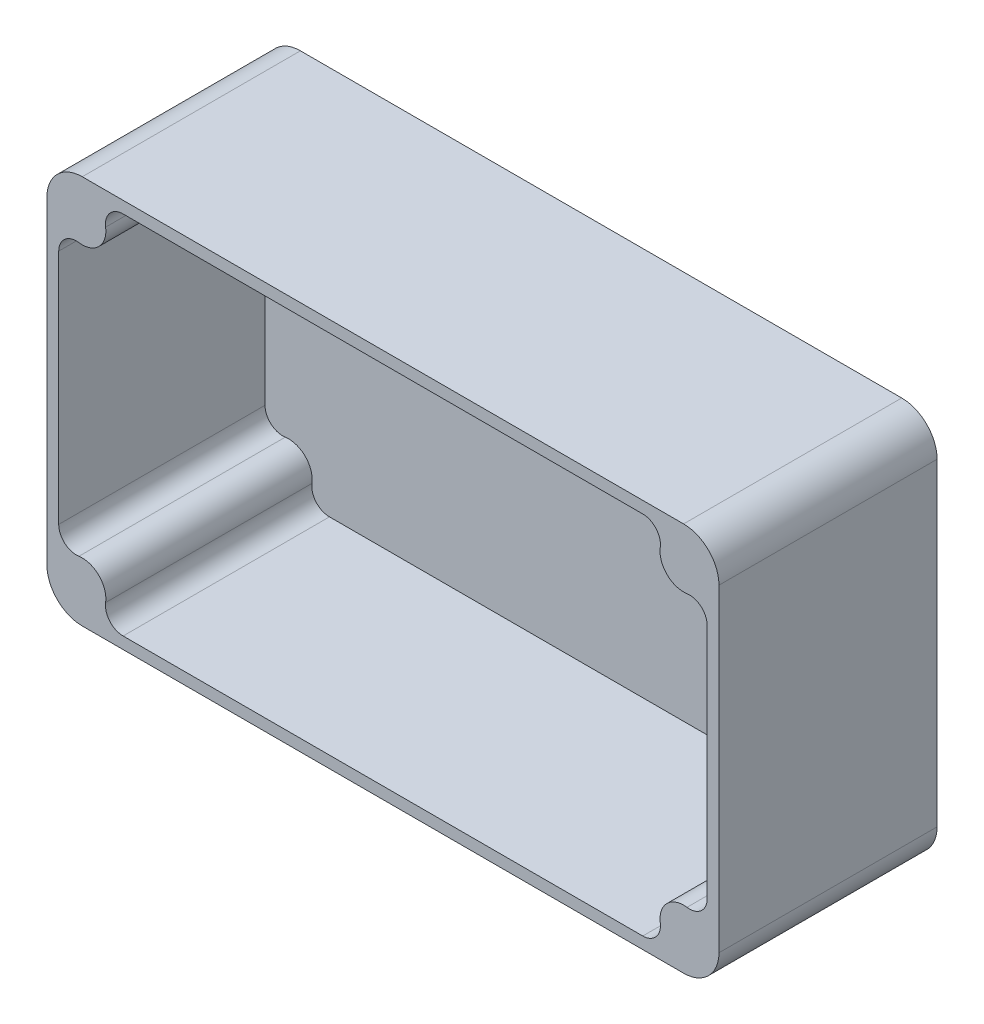
from build123d import *

# Parameters (mm, degrees)
BOSS_EXTRUDE1_DEPTH = 35
SHELL1_T            = 2
SKETCH2_R           = 4
BOSS_EXTRUDE2_DEPTH = 35
FILLET2_START       = -1
FILLET2_DEPTH       = 36


with BuildPart() as part:
    # Sketch1 → Boss-Extrude1 (new body)
    with BuildSketch(Plane.XY):
        with BuildLine():
            Line((-51, -31), (51, -31))
            ThreePointArc((51, -31), (53.828427125, -29.828427125), (55, -27))
            Line((55, -27), (55, 27))
            ThreePointArc((55, 27), (53.828427125, 29.828427125), (51, 31))
            Line((51, 31), (-51, 31))
            ThreePointArc((-51, 31), (-53.828427125, 29.828427125), (-55, 27))
            Line((-55, 27), (-55, -27))
            ThreePointArc((-55, -27), (-53.828427125, -29.828427125), (-51, -31))
        make_face()
    extrude(amount=BOSS_EXTRUDE1_DEPTH)

    # Shell1
    shell1_openings = [part.faces().sort_by_distance(p)[0] for p in [
        (0, 0, 35),
    ]]
    offset(amount=SHELL1_T, openings=shell1_openings, kind=Kind.INTERSECTION)

    # Sketch2 → Boss-Extrude2 (add)
    with BuildSketch(Plane.XY):
        with Locations((-51, 27)):
            Circle(SKETCH2_R)
        with Locations((51, 27)):
            Circle(SKETCH2_R)
        with Locations((51, -27)):
            Circle(SKETCH2_R)
        with Locations((-51, -27)):
            Circle(SKETCH2_R)
    extrude(amount=BOSS_EXTRUDE2_DEPTH)

    # Fillet2: read off the stored shape, not the designer's step
    # Fillet2 outline → Fillet2 (add)
    with BuildSketch(Plane.XY.offset(FILLET2_START)):
        with BuildLine():
            ThreePointArc((51, -31), (48.381385317, -30.023715784), (47.041026725, -27.571428571))
            ThreePointArc((47.041026725, -27.571428571), (46.339583608, -29.963961012), (44.07179677, -31))
            Line((44.07179677, -31), (51, -31))
        make_face()
        with BuildLine():
            ThreePointArc((55, -20.07179677), (53.963961012, -22.339583608), (51.571428571, -23.041026726))
            ThreePointArc((51.571428571, -23.041026726), (54.023715784, -24.381385317), (55, -27))
            Line((55, -27), (55, -20.07179677))
        make_face()
        with BuildLine():
            Line((-51, -31), (-44.07179677, -31))
            ThreePointArc((-44.07179677, -31), (-46.339583608, -29.963961012), (-47.041026726, -27.571428571))
            ThreePointArc((-47.041026726, -27.571428571), (-48.381385317, -30.023715784), (-51, -31))
        make_face()
        with BuildLine():
            ThreePointArc((51.571428571, 23.041026726), (53.963961012, 22.339583608), (55, 20.07179677))
            Line((55, 20.07179677), (55, 27))
            ThreePointArc((55, 27), (54.023715784, 24.381385317), (51.571428571, 23.041026726))
        make_face()
        with BuildLine():
            ThreePointArc((-55, -27), (-54.023715784, -24.381385317), (-51.571428571, -23.041026725))
            ThreePointArc((-51.571428571, -23.041026725), (-53.963961012, -22.339583608), (-55, -20.07179677))
            Line((-55, -20.07179677), (-55, -27))
        make_face()
        with BuildLine():
            ThreePointArc((44.07179677, 31), (46.339583608, 29.963961012), (47.041026726, 27.571428571))
            ThreePointArc((47.041026726, 27.571428571), (48.381385317, 30.023715784), (51, 31))
            Line((51, 31), (44.07179677, 31))
        make_face()
        with BuildLine():
            Line((-55, 27), (-55, 20.07179677))
            ThreePointArc((-55, 20.07179677), (-53.963961012, 22.339583608), (-51.571428571, 23.041026726))
            ThreePointArc((-51.571428571, 23.041026726), (-54.023715784, 24.381385317), (-55, 27))
        make_face()
        with BuildLine():
            ThreePointArc((-47.041026726, 27.571428571), (-46.339583608, 29.963961012), (-44.07179677, 31))
            Line((-44.07179677, 31), (-51, 31))
            ThreePointArc((-51, 31), (-48.381385317, 30.023715784), (-47.041026726, 27.571428571))
        make_face()
    extrude(amount=FILLET2_DEPTH)


solid = part.part
